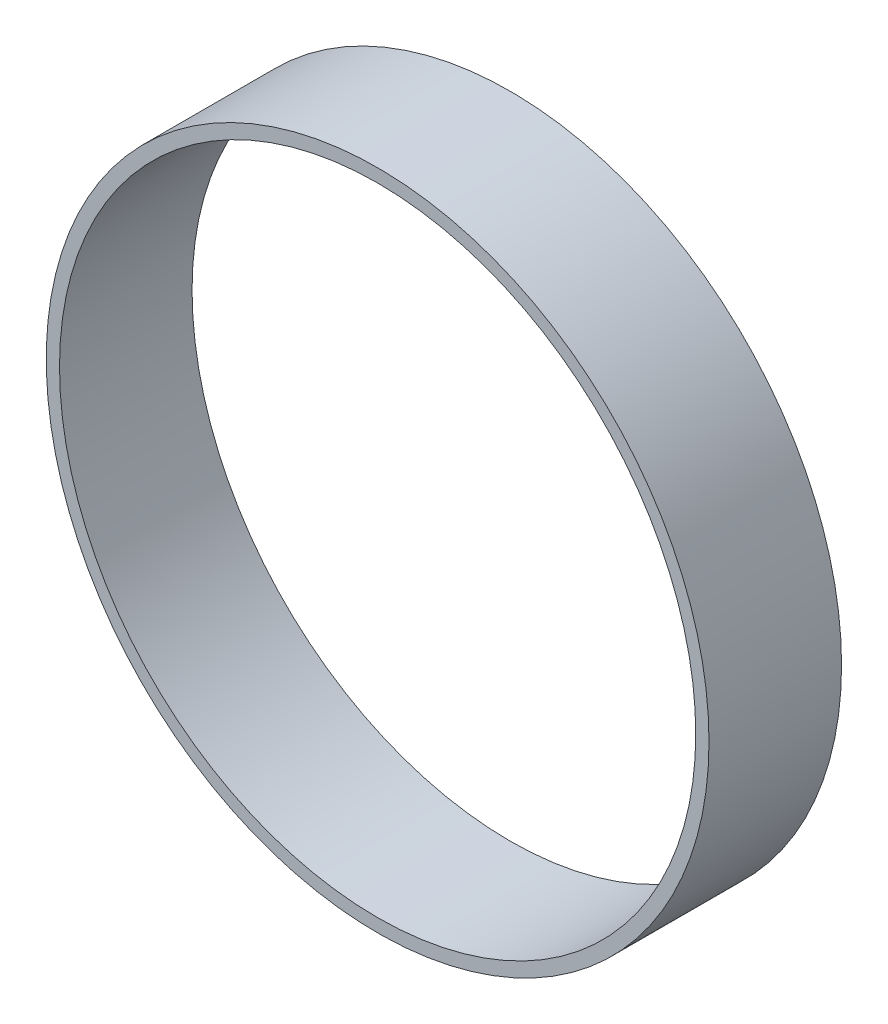
from build123d import *

# Parameters (mm, degrees)
SKETCH1_R           = 75
SKETCH1_R_2         = 72
BOSS_EXTRUDE1_DEPTH = 30


with BuildPart() as part:
    # Sketch1 → Boss-Extrude1 (new body)
    with BuildSketch(Plane.XY):
        Circle(SKETCH1_R)
        Circle(SKETCH1_R_2, mode=Mode.SUBTRACT)
    extrude(amount=BOSS_EXTRUDE1_DEPTH)


solid = part.part
